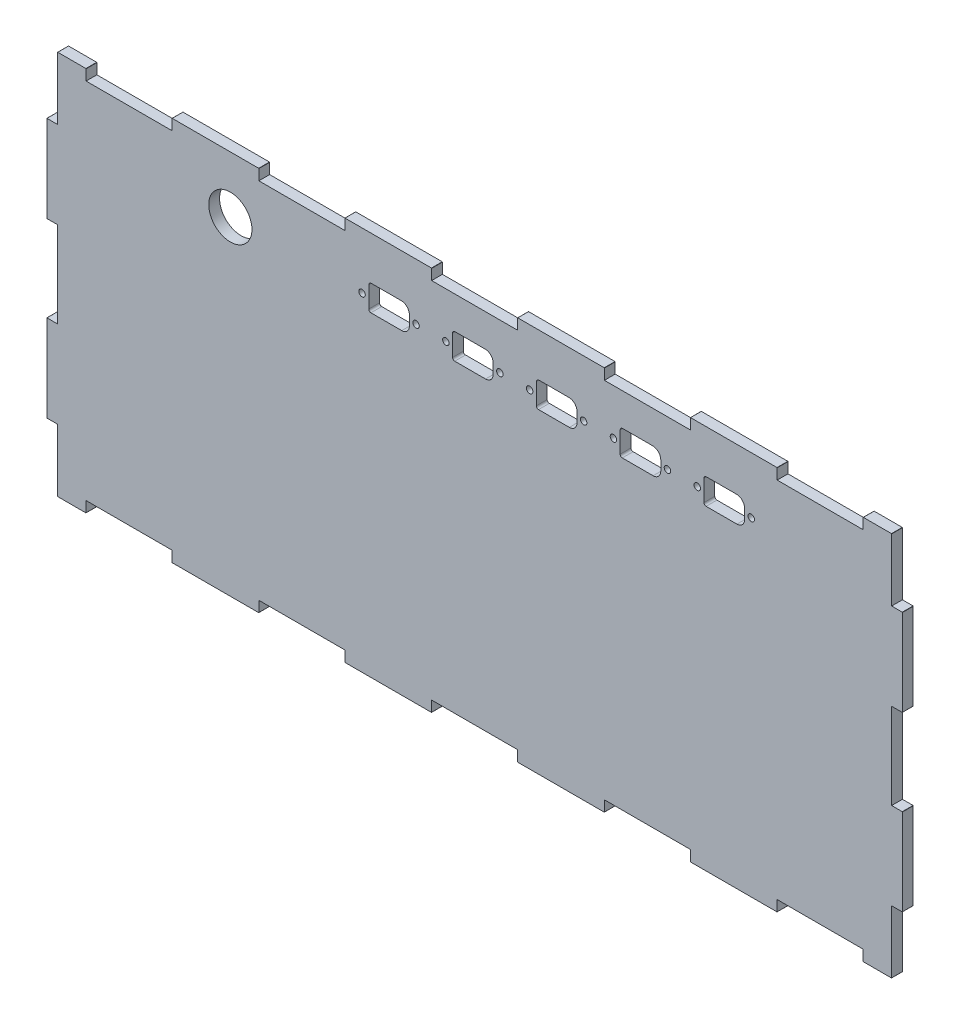
from build123d import *

# Parameters (mm, degrees)
BOSS_EXTRUDE1_DEPTH = 5
SKETCH2_R           = 1.5
CUT_EXTRUDE1_DEPTH  = 218.272685812
SKETCH3_R           = 10
CUT_EXTRUDE2_DEPTH  = 218.272685812


with BuildPart() as part:
    # Model → Boss-Extrude1 (new body)
    with BuildSketch(Plane.XY):
        Polygon((-179.94, -89.08), (-179.93, -89.07), (-179.92, -89.05), (-179.91, -89.04), (-179.9, -89.02), (-179.9, -84.1), (-140.1, -84.1), (-140.1, -89.02), (-140.08, -89.06), (-140.07, -89.07), (-140.05, -89.08), (-140.04, -89.09), (-140.02, -89.1), (-99.98, -89.1), (-99.94, -89.08), (-99.93, -89.07), (-99.92, -89.05), (-99.91, -89.04), (-99.9, -89.02), (-99.9, -84.1), (-60.1, -84.1), (-60.1, -89.02), (-60.08, -89.06), (-60.07, -89.07), (-60.05, -89.08), (-60.04, -89.09), (-60.02, -89.1), (-19.98, -89.1), (-19.94, -89.08), (-19.93, -89.07), (-19.92, -89.05), (-19.91, -89.04), (-19.9, -89.02), (-19.9, -84.1), (19.9, -84.1), (19.9, -89.02), (19.92, -89.06), (19.93, -89.07), (19.95, -89.08), (19.96, -89.09), (19.98, -89.1), (60.02, -89.1), (60.06, -89.08), (60.07, -89.07), (60.08, -89.05), (60.09, -89.04), (60.1, -89.02), (60.1, -84.1), (99.9, -84.1), (99.9, -89.02), (99.92, -89.06), (99.93, -89.07), (99.95, -89.08), (99.96, -89.09), (99.98, -89.1), (140.02, -89.1), (140.06, -89.08), (140.07, -89.07), (140.08, -89.05), (140.09, -89.04), (140.1, -89.02), (140.1, -84.1), (179.9, -84.1), (179.9, -89.02), (179.92, -89.06), (179.93, -89.07), (179.95, -89.08), (179.96, -89.09), (179.98, -89.1), (193.02, -89.1), (193.06, -89.08), (193.07, -89.07), (193.08, -89.05), (193.09, -89.04), (193.1, -89.02), (193.1, -60.1), (198.02, -60.1), (198.06, -60.08), (198.07, -60.07), (198.08, -60.05), (198.09, -60.04), (198.1, -60.02), (198.1, -19.98), (198.08, -19.94), (198.07, -19.93), (198.05, -19.92), (198.04, -19.91), (198.02, -19.9), (193.1, -19.9), (193.1, 19.9), (198.02, 19.9), (198.06, 19.92), (198.07, 19.93), (198.08, 19.95), (198.09, 19.96), (198.1, 19.98), (198.1, 60.02), (198.08, 60.06), (198.07, 60.07), (198.05, 60.08), (198.04, 60.09), (198.02, 60.1), (193.1, 60.1), (193.1, 89.02), (193.08, 89.06), (193.07, 89.07), (193.05, 89.08), (193.04, 89.09), (193.02, 89.1), (179.98, 89.1), (179.94, 89.08), (179.93, 89.07), (179.92, 89.05), (179.91, 89.04), (179.9, 89.02), (179.9, 84.1), (140.1, 84.1), (140.1, 89.02), (140.08, 89.06), (140.07, 89.07), (140.05, 89.08), (140.04, 89.09), (140.02, 89.1), (99.98, 89.1), (99.94, 89.08), (99.93, 89.07), (99.92, 89.05), (99.91, 89.04), (99.9, 89.02), (99.9, 84.1), (60.1, 84.1), (60.1, 89.02), (60.08, 89.06), (60.07, 89.07), (60.05, 89.08), (60.04, 89.09), (60.02, 89.1), (19.98, 89.1), (19.94, 89.08), (19.93, 89.07), (19.92, 89.05), (19.91, 89.04), (19.9, 89.02), (19.9, 84.1), (-19.9, 84.1), (-19.9, 89.02), (-19.92, 89.06), (-19.93, 89.07), (-19.95, 89.08), (-19.96, 89.09), (-19.98, 89.1), (-60.02, 89.1), (-60.06, 89.08), (-60.07, 89.07), (-60.08, 89.05), (-60.09, 89.04), (-60.1, 89.02), (-60.1, 84.1), (-99.9, 84.1), (-99.9, 89.02), (-99.92, 89.06), (-99.93, 89.07), (-99.95, 89.08), (-99.96, 89.09), (-99.98, 89.1), (-140.02, 89.1), (-140.06, 89.08), (-140.07, 89.07), (-140.08, 89.05), (-140.09, 89.04), (-140.1, 89.02), (-140.1, 84.1), (-179.9, 84.1), (-179.9, 89.02), (-179.92, 89.06), (-179.93, 89.07), (-179.95, 89.08), (-179.96, 89.09), (-179.98, 89.1), (-193.02, 89.1), (-193.06, 89.08), (-193.07, 89.07), (-193.08, 89.05), (-193.09, 89.04), (-193.1, 89.02), (-193.1, 60.1), (-198.02, 60.1), (-198.06, 60.08), (-198.07, 60.07), (-198.08, 60.05), (-198.09, 60.04), (-198.1, 60.02), (-198.1, 19.98), (-198.08, 19.94), (-198.07, 19.93), (-198.05, 19.92), (-198.04, 19.91), (-198.02, 19.9), (-193.1, 19.9), (-193.1, -19.9), (-198.02, -19.9), (-198.06, -19.92), (-198.07, -19.93), (-198.08, -19.95), (-198.09, -19.96), (-198.1, -19.98), (-198.1, -60.02), (-198.08, -60.06), (-198.07, -60.07), (-198.05, -60.08), (-198.04, -60.09), (-198.02, -60.1), (-193.1, -60.1), (-193.1, -89.02), (-193.08, -89.06), (-193.07, -89.07), (-193.05, -89.08), (-193.04, -89.09), (-193.02, -89.1), (-179.98, -89.1), align=None)
    extrude(amount=BOSS_EXTRUDE1_DEPTH)

    # Sketch2 → Cut-Extrude1 (cut, through all)
    with BuildSketch(Plane.XY.offset(5)):
        with Locations((-52.108840949, 62.97)):
            Circle(SKETCH2_R)
        with Locations((-27.108840949, 62.97)):
            Circle(SKETCH2_R)
        with Locations((-13.308840949, 62.97)):
            Circle(SKETCH2_R)
        with Locations((11.691159051, 62.97)):
            Circle(SKETCH2_R)
        with Locations((25.491159051, 62.97)):
            Circle(SKETCH2_R)
        with Locations((50.491159051, 62.97)):
            Circle(SKETCH2_R)
        with Locations((64.291159051, 62.97)):
            Circle(SKETCH2_R)
        with Locations((89.291159051, 62.97)):
            Circle(SKETCH2_R)
        with Locations((103.091159051, 62.97)):
            Circle(SKETCH2_R)
        with Locations((128.091159051, 62.97)):
            Circle(SKETCH2_R)
        with BuildLine():
            Line((-33.733840949, 57.12), (-48.008840949, 57.12))
            ThreePointArc((-48.008840949, 57.12), (-48.71594773, 57.412893219), (-49.008840949, 58.12))
            Line((-49.008840949, 58.12), (-49.008840949, 67.82))
            ThreePointArc((-49.008840949, 67.82), (-48.657369086, 68.668528137), (-47.808840949, 69.02))
            Line((-47.808840949, 69.02), (-33.933840949, 69.02))
            ThreePointArc((-33.933840949, 69.02), (-31.299868189, 67.92897276), (-30.208840949, 65.295))
            Line((-30.208840949, 65.295), (-30.208840949, 60.645))
            ThreePointArc((-30.208840949, 60.645), (-31.241289545, 58.152448596), (-33.733840949, 57.12))
        make_face()
        with BuildLine():
            Line((5.066159051, 57.12), (-9.208840949, 57.12))
            ThreePointArc((-9.208840949, 57.12), (-9.91594773, 57.412893219), (-10.208840949, 58.12))
            Line((-10.208840949, 58.12), (-10.208840949, 67.82))
            ThreePointArc((-10.208840949, 67.82), (-9.857369086, 68.668528137), (-9.008840949, 69.02))
            Line((-9.008840949, 69.02), (4.866159051, 69.02))
            ThreePointArc((4.866159051, 69.02), (7.500131811, 67.92897276), (8.591159051, 65.295))
            Line((8.591159051, 65.295), (8.591159051, 60.645))
            ThreePointArc((8.591159051, 60.645), (7.558710455, 58.152448596), (5.066159051, 57.12))
        make_face()
        with BuildLine():
            Line((43.866159051, 57.12), (29.591159051, 57.12))
            ThreePointArc((29.591159051, 57.12), (28.88405227, 57.412893219), (28.591159051, 58.12))
            Line((28.591159051, 58.12), (28.591159051, 67.82))
            ThreePointArc((28.591159051, 67.82), (28.942630914, 68.668528137), (29.791159051, 69.02))
            Line((29.791159051, 69.02), (43.666159051, 69.02))
            ThreePointArc((43.666159051, 69.02), (46.300131811, 67.92897276), (47.391159051, 65.295))
            Line((47.391159051, 65.295), (47.391159051, 60.645))
            ThreePointArc((47.391159051, 60.645), (46.358710455, 58.152448596), (43.866159051, 57.12))
        make_face()
        with BuildLine():
            Line((82.666159051, 57.12), (68.391159051, 57.12))
            ThreePointArc((68.391159051, 57.12), (67.68405227, 57.412893219), (67.391159051, 58.12))
            Line((67.391159051, 58.12), (67.391159051, 67.82))
            ThreePointArc((67.391159051, 67.82), (67.742630914, 68.668528137), (68.591159051, 69.02))
            Line((68.591159051, 69.02), (82.466159051, 69.02))
            ThreePointArc((82.466159051, 69.02), (85.100131811, 67.92897276), (86.191159051, 65.295))
            Line((86.191159051, 65.295), (86.191159051, 60.645))
            ThreePointArc((86.191159051, 60.645), (85.158710455, 58.152448596), (82.666159051, 57.12))
        make_face()
        with BuildLine():
            Line((121.466159051, 57.12), (107.191159051, 57.12))
            ThreePointArc((107.191159051, 57.12), (106.48405227, 57.412893219), (106.191159051, 58.12))
            Line((106.191159051, 58.12), (106.191159051, 67.82))
            ThreePointArc((106.191159051, 67.82), (106.542630914, 68.668528137), (107.391159051, 69.02))
            Line((107.391159051, 69.02), (121.266159051, 69.02))
            ThreePointArc((121.266159051, 69.02), (123.900131811, 67.92897276), (124.991159051, 65.295))
            Line((124.991159051, 65.295), (124.991159051, 60.645))
            ThreePointArc((124.991159051, 60.645), (123.958710455, 58.152448596), (121.466159051, 57.12))
        make_face()
    extrude(amount=-CUT_EXTRUDE1_DEPTH, mode=Mode.SUBTRACT)

    # Sketch3 → Cut-Extrude2 (cut, through all)
    with BuildSketch(Plane.XY.offset(5)):
        with Locations((-113.1, 62.97)):
            Circle(SKETCH3_R)
    extrude(amount=-CUT_EXTRUDE2_DEPTH, mode=Mode.SUBTRACT)


solid = part.part
